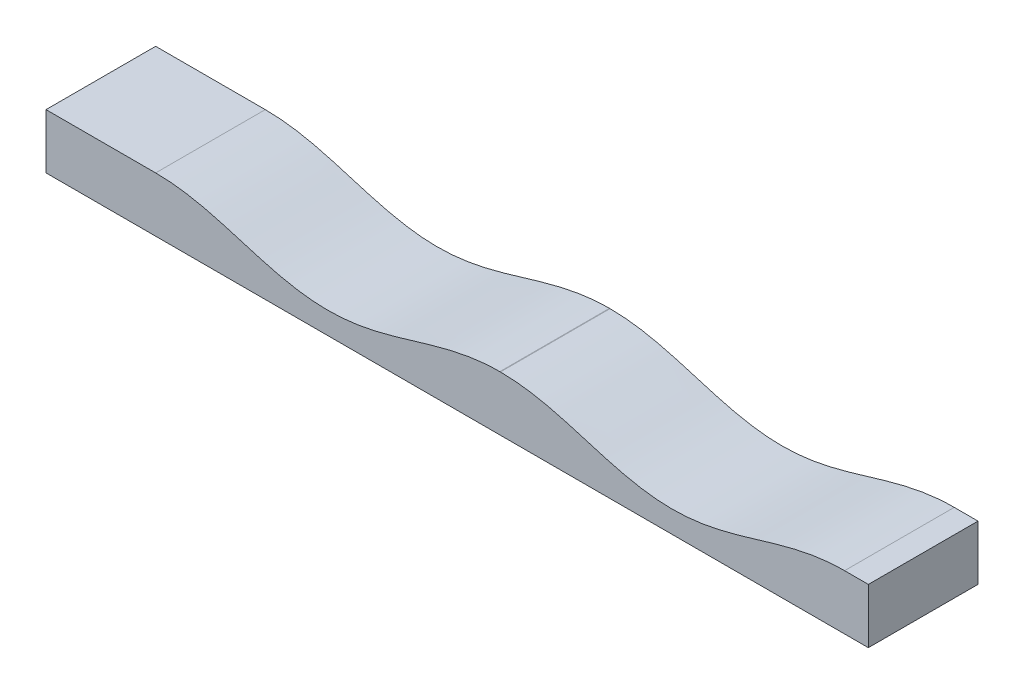
from build123d import *

# Parameters (mm, degrees)
SKETCH1_W           = 150
SKETCH1_H           = 20
BOSS_EXTRUDE1_DEPTH = 10
CUT_EXTRUDE1_START  = -10
CUT_EXTRUDE1_DEPTH  = 20


# Read off the part's stored shape, not the designer's step: Cut-Extrude1
with BuildPart() as part:
    # Sketch1 → Boss-Extrude1 (new body)
    with BuildSketch(Plane(origin=(0, 0, 0), x_dir=(1, 0, 0), z_dir=(0, 1, 0))):
        with Locations((75, 0)):
            Rectangle(SKETCH1_W, SKETCH1_H)
    extrude(amount=BOSS_EXTRUDE1_DEPTH)

    # Cut-Extrude1 outline → Cut-Extrude1 (cut)
    with BuildSketch(Plane.XY.offset(CUT_EXTRUDE1_START)):
        with BuildLine():
            Line((145.663706144, 10), (82.885627876, 10))
            add(Edge.make_bspline(
                [(82.885627876, 10), (83.454977242, 9.99908028), (85.189856894, 9.956715888), (87.907695594, 9.701054679), (91.559145724, 8.993968627), (95.686256106, 7.87353082), (99.738781969, 6.629157705), (103.976290755, 5.384778121), (108.462250932, 4.377105952), (113.07700456, 3.880999352), (117.435005853, 4.040590194), (121.419605992, 4.675271787), (124.770171836, 5.486196921), (127.524123563, 6.268788566), (130.011090761, 7.016713264), (132.243780847, 7.687596399), (134.256371731, 8.261450185), (136.051140973, 8.727311429), (137.62554634, 9.089746646), (138.975122408, 9.362602964), (140.280663194, 9.584826082), (141.395781757, 9.73738392), (142.317885087, 9.837112449), (143.042775212, 9.899645746), (143.62744465, 9.939940775), (144.131855587, 9.966526877), (144.563142562, 9.98303354), (144.948720651, 9.992572398), (145.266405122, 9.997664685), (145.481284706, 9.999575397), (145.602944701, 10), (145.663706144, 10)],
                knots=[0.500349192, 0.500349192, 0.500349192, 0.500349192, 0.500349192, 0.515137701, 0.545413215, 0.571111647, 0.596810078, 0.626167806, 0.655525534, 0.685801031, 0.716076475, 0.746351906, 0.768391073, 0.790430241, 0.805568, 0.82070576, 0.83584352, 0.850981279, 0.859920909, 0.868860539, 0.877800169, 0.886739799, 0.894308658, 0.898093088, 0.901877518, 0.905661948, 0.909446378, 0.911338593, 0.913230808, 0.915123023, 0.917015238, 0.917015238, 0.917015238, 0.917015238, 0.917015238], degree=4))
        make_face()
        with BuildLine():
            add(Edge.make_bspline(
                [(20, 10), (20.060761442, 10), (20.182421455, 9.999575397), (20.39730103, 9.997664685), (20.714985555, 9.992572396), (21.100563711, 9.983033535), (21.531850968, 9.966526863), (22.036257221, 9.939940915), (22.620943851, 9.899645334), (23.345787497, 9.837113466), (24.096799885, 9.755896382), (24.871456236, 9.654807845), (25.840152712, 9.50702943), (26.68771304, 9.358248058), (27.532076328, 9.192071608), (28.373135333, 9.010270215), (29.044068, 8.856194438), (30.112337945, 8.597574089), (31.5728561, 8.214295395), (33.419910315, 7.687526736), (35.652632055, 7.016810348), (37.733272252, 6.390851426), (39.669106538, 5.834266358), (41.872853105, 5.249081541), (44.663768524, 4.608489653), (48.228694342, 4.040548399), (52.586705214, 3.881024842), (57.20145294, 4.377090051), (61.687417049, 5.384789657), (65.924923136, 6.629150647), (69.977450635, 7.873534607), (74.104560079, 8.993966893), (77.756009619, 9.701054871), (80.473847019, 9.956715992), (82.208725521, 9.999080282), (82.77807377, 10)],
                knots=[0.082984762, 0.082984762, 0.082984762, 0.082984762, 0.082984762, 0.084876977, 0.086769192, 0.088661407, 0.090553622, 0.094338052, 0.098122482, 0.101906912, 0.105691342, 0.113260201, 0.117730016, 0.122199831, 0.131139461, 0.135609276, 0.140079091, 0.144548906, 0.149018721, 0.16415648, 0.17929424, 0.194432, 0.209569759, 0.220589343, 0.231608927, 0.253648094, 0.283923525, 0.314198969, 0.344474466, 0.373832194, 0.403189922, 0.428888353, 0.454586785, 0.484862299, 0.499650779, 0.499650779, 0.499650779, 0.499650779, 0.499650779], degree=4))
            Line((82.77807377, 10), (20, 10))
        make_face()
    extrude(amount=CUT_EXTRUDE1_DEPTH, mode=Mode.SUBTRACT)


solid = part.part
